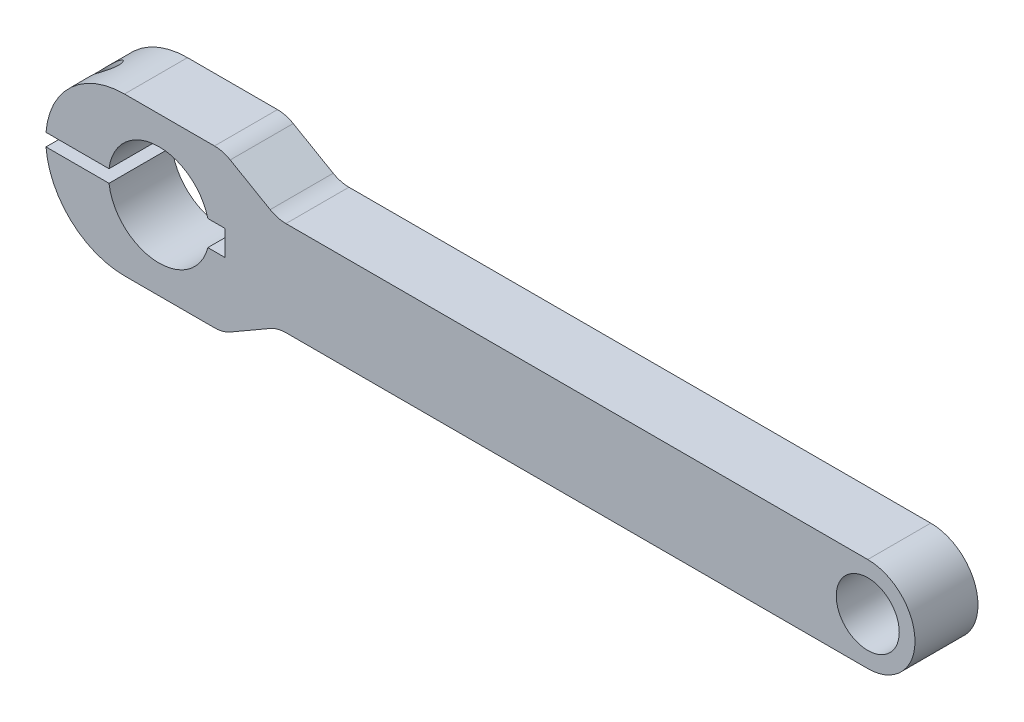
from build123d import *

# Parameters (mm, degrees)
ESQUISSE1_R             = 16
ESQUISSE1_R_2           = 10
BOSS_EXTRU_1_DEPTH      = 20
CONG_1_R                = 10
ESQUISSE2_W             = 29.871343772
ESQUISSE2_H             = 8
ENL_V_MAT_EXTRU_1_DEPTH = 384.442878679
BOSS_EXTRU_2_DEPTH      = 20
ESQUISSE4_W             = 24.009444984
ESQUISSE4_H             = 4
ENL_V_MAT_EXTRU_2_DEPTH = 20
ESQUISSE5_R             = 3.5
ENL_V_MAT_EXTRU_3_DEPTH = 36
ESQUISSE6_R             = 4.5
ENL_V_MAT_EXTRU_4_DEPTH = 36
ESQUISSE7_R             = 7
ENL_V_MAT_EXTRU_5_DEPTH = 36


with BuildPart() as part:
    # Esquisse1 → Boss.-Extru.1 (new body)
    with BuildSketch(Plane.XY):
        with BuildLine():
            Line((-262.391265779, 162.493064596), (-75, 162.493064596))
            ThreePointArc((-75, 162.493064596), (-60, 177.493064596), (-75, 192.493064596))
            Line((-75, 192.493064596), (-262.391265779, 192.493064596))
            Line((-262.391265779, 192.493064596), (-279.711773855, 202.493064596))
            Line((-279.711773855, 202.493064596), (-300, 202.493064596))
            ThreePointArc((-300, 202.493064596), (-325, 177.493064596), (-300, 152.493064596))
            Line((-300, 152.493064596), (-279.711773855, 152.493064596))
            Line((-279.711773855, 152.493064596), (-262.391265779, 162.493064596))
        make_face()
        with Locations((-300, 177.493064596)):
            Circle(ESQUISSE1_R, mode=Mode.SUBTRACT)
        with Locations((-75, 177.493064596)):
            Circle(ESQUISSE1_R_2, mode=Mode.SUBTRACT)
    extrude(amount=BOSS_EXTRU_1_DEPTH)

    # Congé1
    cong_1_edges = [part.edges().sort_by_distance(p)[0] for p in [
        (-262.391265779, 162.493064596, 10),
        (-279.711773855, 152.493064596, 10),
        (-279.711773855, 202.493064596, 10),
        (-262.391265779, 192.493064596, 10),
    ]]
    fillet(cong_1_edges, radius=CONG_1_R)

    # Esquisse2 → Enlèv. mat.-Extru.1 (cut, through all)
    with BuildSketch(Plane.XY.offset(20)):
        with Locations((-293.935671886, 177.493064596)):
            Rectangle(ESQUISSE2_W, ESQUISSE2_H)
    extrude(amount=-ENL_V_MAT_EXTRU_1_DEPTH, mode=Mode.SUBTRACT)

    # Esquisse3 → Boss.-Extru.2 (add)
    with BuildSketch(Plane(origin=(0, 0, 0), x_dir=(-1, 0, 0), z_dir=(0, 0, -1))):
        with BuildLine():
            Line((310.960972955, 202.493064596), (294.879538783, 202.493064596))
            Line((294.879538783, 202.493064596), (293.738101821, 195.614121682))
            ThreePointArc((293.738101821, 195.614121682), (319.17248233, 177.493064596), (293.738101821, 159.372007511))
            Line((293.738101821, 159.372007511), (296.010264623, 152.493064596))
            Line((296.010264623, 152.493064596), (310.960972955, 152.493064596))
            ThreePointArc((310.960972955, 152.493064596), (335.960972955, 177.493064596), (310.960972955, 202.493064596))
        make_face()
    extrude(amount=-BOSS_EXTRU_2_DEPTH)

    # Esquisse4 → Enlèv. mat.-Extru.2 (cut)
    with BuildSketch(Plane(origin=(0, 0, 0), x_dir=(-1, 0, 0), z_dir=(0, 0, -1))):
        with Locations((326.099914325, 177.493064596)):
            Rectangle(ESQUISSE4_W, ESQUISSE4_H)
    extrude(amount=-ENL_V_MAT_EXTRU_2_DEPTH, mode=Mode.SUBTRACT)

    # Esquisse5 → Enlèv. mat.-Extru.3 (cut)
    with BuildSketch(Plane.XZ.offset(-179.493064596)):
        with Locations((-326.297546771, 10)):
            Circle(ESQUISSE5_R)
    extrude(amount=-ENL_V_MAT_EXTRU_3_DEPTH, mode=Mode.SUBTRACT)

    # Esquisse6 → Enlèv. mat.-Extru.4 (cut)
    with BuildSketch(Plane(origin=(0, 175.493064596, 0), x_dir=(1, 0, 0), z_dir=(0, 1, 0))):
        with Locations((-326.297546771, -10)):
            Circle(ESQUISSE6_R)
    extrude(amount=-ENL_V_MAT_EXTRU_4_DEPTH, mode=Mode.SUBTRACT)

    # Esquisse7 → Enlèv. mat.-Extru.5 (cut)
    with BuildSketch(Plane(origin=(0, 170.493064596, 0), x_dir=(-1, 0, 0), z_dir=(0, 1, 0))):
        with Locations((326.297546771, 10)):
            Circle(ESQUISSE7_R)
    extrude(amount=-ENL_V_MAT_EXTRU_5_DEPTH, mode=Mode.SUBTRACT)


solid = part.part
